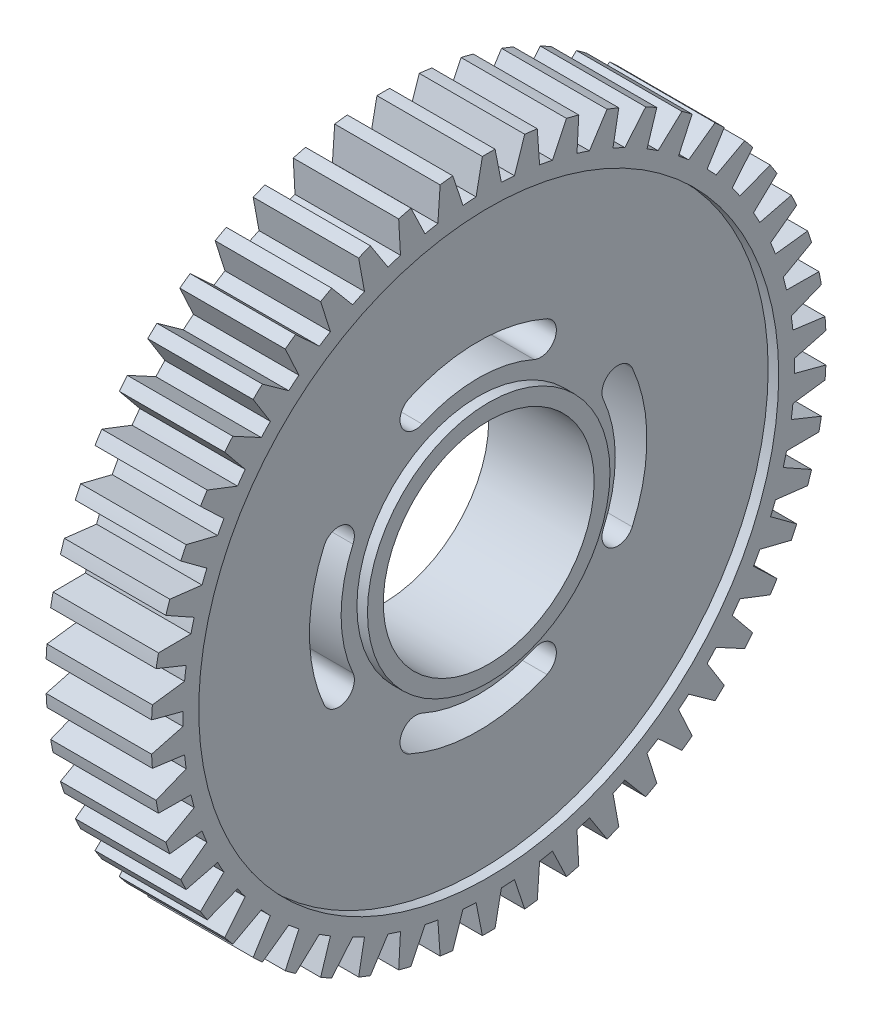
from build123d import *

# Parameters (mm, degrees)
SKETCH1_R           = 29
SKETCH1_R_2         = 11.5
BOSS_EXTRUDE1_DEPTH = 4
SKETCH1_3_R         = 29
SKETCH1_3_R_2       = 27.5
SKETCH1_3_R_3       = 11.5
SKETCH1_3_R_4       = 10
BOSS_EXTRUDE2_DEPTH = 5
BOSS_EXTRUDE3_DEPTH = 5
CIRPATTERN1_COUNT   = 50
CUT_EXTRUDE2_DEPTH  = 46.508402475
FILLET1_START       = -4
FILLET1_DEPTH       = 8
FILLET2_START       = -4
FILLET2_DEPTH       = 8
CIRPATTERN2_COUNT   = 4


with BuildPart() as part:
    # Sketch1 → Boss-Extrude1 (new, symmetric)
    with BuildSketch(Plane.YZ):
        with Locations(Location((0, 0, 0), (0, 0, 270))):
            Circle(SKETCH1_R)
        with Locations(Location((0, 0, 0), (0, 0, 270))):
            Circle(SKETCH1_R_2, mode=Mode.SUBTRACT)
    extrude(amount=BOSS_EXTRUDE1_DEPTH, both=True)

    # Sketch1<3> → Boss-Extrude2 (add, symmetric)
    # profile 1 of 2: a face of its own
    with BuildSketch(Plane.YZ):
        with Locations(Location((0, 0, 0), (0, 0, 270))):
            Circle(SKETCH1_3_R)
        with Locations(Location((0, 0, 0), (0, 0, 270))):
            Circle(SKETCH1_3_R_2, mode=Mode.SUBTRACT)
    # profile 2 of 2: a face of its own
    with BuildSketch(Plane.YZ):
        with Locations(Location((0, 0, 0), (0, 0, 270))):
            Circle(SKETCH1_3_R_3)
        with Locations(Location((0, 0, 0), (0, 0, 270))):
            Circle(SKETCH1_3_R_4, mode=Mode.SUBTRACT)
    extrude(amount=BOSS_EXTRUDE2_DEPTH, both=True)

    # Sketch1<4> → Boss-Extrude3 (add, symmetric)
    with BuildSketch(Plane.YZ):
        with BuildLine():
            ThreePointArc((31.994353482, -0.60112003), (31.998588339, -0.300573275), (32, 0))
            ThreePointArc((32, 0), (31.998588339, 0.300573275), (31.994353482, 0.60112003))
            Line((31.994353482, 0.60112003), (28.975161777, 1.2))
            ThreePointArc((28.975161777, 1.2), (28.993789779, 0.600128515), (29, 0))
            ThreePointArc((29, 0), (28.993789779, -0.600128515), (28.975161777, -1.2))
            Line((28.975161777, -1.2), (31.994353482, -0.60112003))
        make_face()
    boss_extrude3 = extrude(amount=BOSS_EXTRUDE3_DEPTH, both=True)

    # CirPattern1: Boss-Extrude3 ×50 about axis
    cirpattern1_axis = Axis((0, 0, 0), (1, 0, 0))
    for i in range(1, CIRPATTERN1_COUNT):
        add(boss_extrude3.rotate(cirpattern1_axis, i * 360 / CIRPATTERN1_COUNT))

    # Sketch1<6> → Cut-Extrude2 (cut, symmetric)
    with BuildSketch(Plane.YZ):
        with BuildLine():
            ThreePointArc((-6.5, 11.258330249), (0, 13), (6.5, 11.258330249))
            Line((6.5, 11.258330249), (8, 13.856406461))
            ThreePointArc((8, 13.856406461), (0, 16), (-8, 13.856406461))
            Line((-8, 13.856406461), (-6.5, 11.258330249))
        make_face()
    cut_extrude2 = extrude(amount=CUT_EXTRUDE2_DEPTH, both=True, mode=Mode.SUBTRACT)

    # Fillet1: read off the stored shape, not the designer's step
    # Fillet1 outline → Fillet1 (add)
    with BuildSketch(Plane.YZ.offset(FILLET1_START)):
        with BuildLine():
            ThreePointArc((-6.5, 11.258330249), (-5.908165679, 11.579878165), (-5.300471571, 11.870341239))
            add(Edge.make_bspline(
                [(-5.300471571, 11.870341239), (-5.62097103, 11.727228396), (-6.029597703, 11.655683844), (-6.496578351, 11.727639411), (-6.932882302, 12.008104397), (-7.211102546, 12.489995989)],
                knots=[0, 0, 0, 0, 0, 0, 0.474068366, 0.474068366, 0.474068366, 0.474068366, 0.474068366, 0.474068366], degree=5, weights=[1, 0.810372654, 0.66569347, 0.56596245, 0.511179593, 0.501344899]))
            Line((-7.211102546, 12.489995989), (-6.5, 11.258330249))
        make_face()
        with BuildLine():
            Line((-8, 13.856406461), (-7.211102546, 12.489995989))
            add(Edge.make_bspline(
                [(-7.211102546, 12.489995989), (-7.532816375, 13.047220679), (-7.525071781, 13.652742597), (-7.259064797, 14.138057651), (-6.888560975, 14.446710077), (-6.523657318, 14.609650755)],
                knots=[0.474068366, 0.474068366, 0.474068366, 0.474068366, 0.474068366, 0.474068366, 1, 1, 1, 1, 1, 1], degree=5, weights=[0.501344899, 0.490434286, 0.534844489, 0.634575509, 0.789627346, 1]))
            ThreePointArc((-6.523657318, 14.609650755), (-7.271588528, 14.252157742), (-8, 13.856406461))
        make_face()
    fillet1 = extrude(amount=FILLET1_DEPTH)

    # Fillet2: read off the stored shape, not the designer's step
    # Fillet2 outline → Fillet2 (add)
    with BuildSketch(Plane.YZ.offset(FILLET2_START)):
        with BuildLine():
            ThreePointArc((8, 13.856406461), (7.271588528, 14.252157742), (6.523657319, 14.609650756))
            add(Edge.make_bspline(
                [(6.523657319, 14.609650756), (6.888562857, 14.446709236), (7.259068551, 14.138054524), (7.525075636, 13.652735564), (7.532816513, 13.047209924), (7.21109614, 12.489984893)],
                knots=[0, 0, 0, 0, 0, 0, 0.525933775, 0.525933775, 0.525933775, 0.525933775, 0.525933775, 0.525933775], degree=5, weights=[1, 0.78962649, 0.634574247, 0.534843271, 0.490433563, 0.501345121]))
            Line((7.21109614, 12.489984893), (8, 13.856406461))
        make_face()
        with BuildLine():
            Line((6.5, 11.258330249), (7.21109614, 12.489984893))
            add(Edge.make_bspline(
                [(7.21109614, 12.489984893), (6.932873575, 12.008098787), (6.496570908, 11.727638264), (6.02959321, 11.655684631), (5.620969244, 11.727229194), (5.300471572, 11.870341239)],
                knots=[0.525933775, 0.525933775, 0.525933775, 0.525933775, 0.525933775, 0.525933775, 1, 1, 1, 1, 1, 1], degree=5, weights=[0.501345121, 0.511180583, 0.565963802, 0.665694777, 0.81037351, 1]))
            ThreePointArc((5.300471572, 11.870341239), (5.908165679, 11.579878165), (6.5, 11.258330249))
        make_face()
    fillet2 = extrude(amount=FILLET2_DEPTH)

    # CirPattern2: Cut-Extrude2, Fillet1, Fillet2 ×4 about axis
    cirpattern2_axis = Axis((4, 0, 0), (1, 0, 0))
    add([cut_extrude2.rotate(cirpattern2_axis, i * 360 / CIRPATTERN2_COUNT) for i in range(1, CIRPATTERN2_COUNT)], mode=Mode.SUBTRACT)
    add([fillet1.rotate(cirpattern2_axis, i * 360 / CIRPATTERN2_COUNT) for i in range(1, CIRPATTERN2_COUNT)])
    add([fillet2.rotate(cirpattern2_axis, i * 360 / CIRPATTERN2_COUNT) for i in range(1, CIRPATTERN2_COUNT)])


solid = part.part
